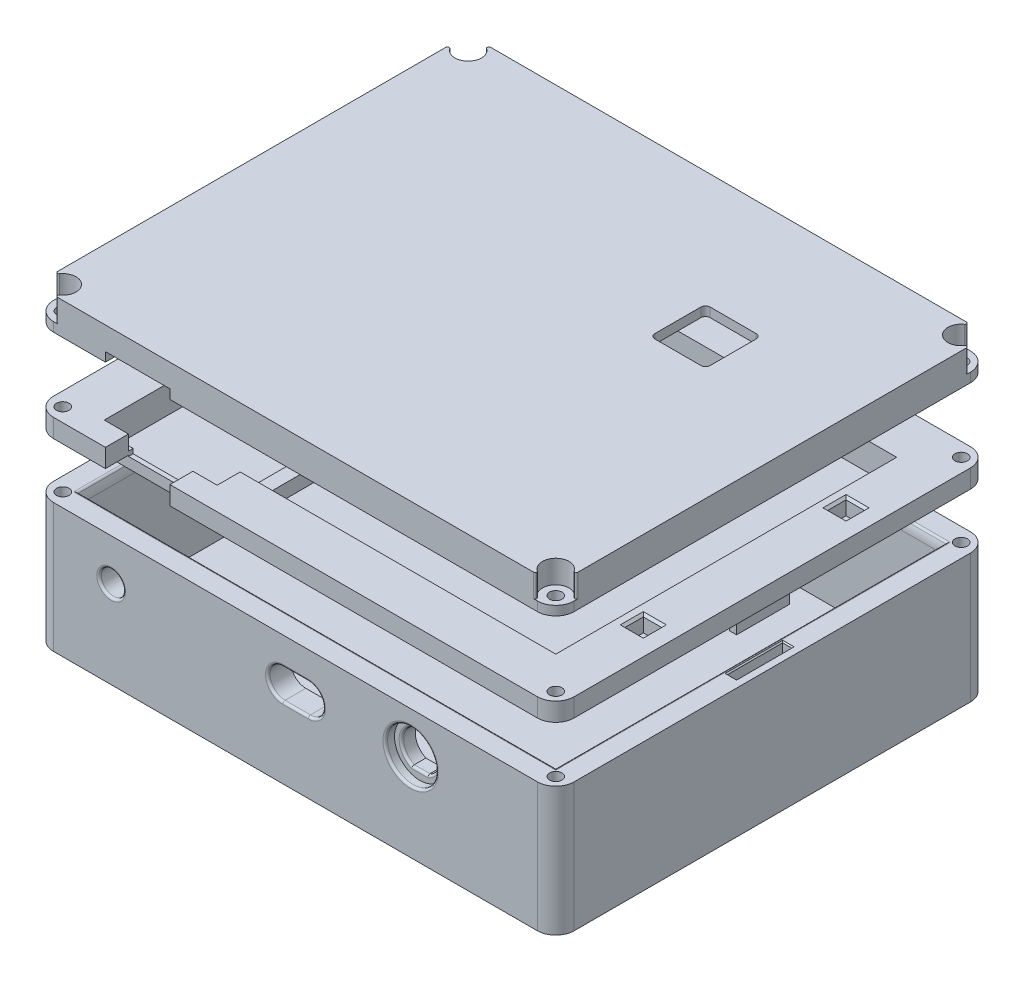
from build123d import *

# Parameters (mm, degrees)
BOSS_EXTRUDE1_DEPTH  = 4
BOSS_EXTRUDE2_START  = 4
SKETCH1_3_W          = 103
SKETCH1_3_H          = 84
BOSS_EXTRUDE2_DEPTH  = 24
BOSS_EXTRUDE3_START  = 4
SKETCH1_4_W          = 1.5
SKETCH1_4_H          = 12
SKETCH1_4_W_2        = 2.5
SKETCH1_4_H_2        = 1.5
BOSS_EXTRUDE3_DEPTH  = 8
CHAMFER1_SIZE        = 1
SKETCH2_R            = 2.625
CUT_EXTRUDE1_DEPTH   = 11
CUT_EXTRUDE2_START   = 5
SKETCH2_3_R          = 5.5
CUT_EXTRUDE2_DEPTH   = 2
CHAMFER2_SIZE        = 0.5
FILLET1_R            = 5
FILLET2_R            = 0.5
SKETCH3_R            = 1.35
CUT_EXTRUDE3_DEPTH   = 8
SKETCH3_3_W          = 2
SKETCH3_3_H          = 12
CUT_EXTRUDE12_DEPTH  = 4
SKETCH4_R            = 1.35
SKETCH4_W            = 103
SKETCH4_H            = 84
BOSS_EXTRUDE4_DEPTH  = 4
SKETCH4_5_W          = 1.5
SKETCH4_5_H          = 11.5
BOSS_EXTRUDE7_DEPTH  = 4
BOSS_EXTRUDE5_DEPTH  = 4
BOSS_EXTRUDE6_START  = -4
SKETCH4_4_W          = 93
SKETCH4_4_H          = 74
BOSS_EXTRUDE6_DEPTH  = 2
SKETCH5_W            = 24.5
SKETCH5_H            = 2
BOSS_EXTRUDE8_DEPTH  = 5
CHAMFER3_SIZE        = 1.5
SKETCH7_W            = 24.5
SKETCH7_H            = 3.053918574
BOSS_EXTRUDE11_DEPTH = 1
SKETCH6_W            = 14
SKETCH6_H            = 5.018415589
CUT_EXTRUDE4_DEPTH   = 7.5
BOSS_EXTRUDE12_DEPTH = 3
SKETCH8_3_W          = 16
SKETCH8_3_H          = 4
CUT_EXTRUDE5_DEPTH   = 3.5
CHAMFER4_SIZE        = 1
CUT_EXTRUDE6_START   = 6
SKETCH10_W           = 4
SKETCH10_H           = 4
CUT_EXTRUDE6_DEPTH   = 3.5
SKETCH10_3_R         = 0.8
BOSS_EXTRUDE13_DEPTH = 1.5
SKETCH10_4_W         = 2
SKETCH10_4_H         = 1.75
CUT_EXTRUDE7_DEPTH   = 2
FILLET3_R            = 0.5
CHAMFER5_SIZE        = 0.5
SKETCH12_W           = 3.3
SKETCH12_H           = 3.3
BOSS_EXTRUDE14_DEPTH = 5
SKETCH13_W           = 14
SKETCH13_H           = 2
CUT_EXTRUDE8_DEPTH   = 10
BOSS_EXTRUDE15_START = 5
SKETCH12_3_W         = 3.3
SKETCH12_3_H         = 3.3
BOSS_EXTRUDE15_DEPTH = 2
CUT_EXTRUDE9_START   = 7
SKETCH14_R           = 1.35
CUT_EXTRUDE9_DEPTH   = 7
CUT_EXTRUDE10_START  = 2
SKETCH14_3_R         = 2.875
CUT_EXTRUDE10_DEPTH  = 5
FILLET4_R            = 0.35
SKETCH17_R           = 5
CUT_EXTRUDE11_DEPTH  = 5
CHAMFER6_SIZE        = 0.25
FILLET5_R            = 1
FILLET6_R            = 0.5
SKETCH18_W           = 4
SKETCH18_H           = 4
SKETCH18_W_2         = 3
SKETCH18_H_2         = 3
CUT_EXTRUDE13_DEPTH  = 3
CHAMFER7_SIZE        = 0.325


with BuildPart() as part:
    # Sketch1 → Boss-Extrude1 (new body)
    with BuildSketch(Plane(origin=(0, 0, 0), x_dir=(1, 0, 0), z_dir=(0, 1, 0))):
        with BuildLine():
            Line((-1, 89), (104, 89))
            ThreePointArc((104, 89), (106.828427125, 87.828427125), (108, 85))
            Line((108, 85), (108, -1))
            ThreePointArc((108, -1), (106.828427125, -3.828427125), (104, -5))
            Line((104, -5), (-1, -5))
            ThreePointArc((-1, -5), (-3.828427125, -3.828427125), (-5, -1))
            Line((-5, -1), (-5, 85))
            ThreePointArc((-5, 85), (-3.828427125, 87.828427125), (-1, 89))
        make_face()
    extrude(amount=BOSS_EXTRUDE1_DEPTH)

    # Sketch1<3> → Boss-Extrude2 (add)
    with BuildSketch(Plane(origin=(0, 0, 0), x_dir=(1, 0, 0), z_dir=(0, 1, 0)).offset(BOSS_EXTRUDE2_START)):
        with BuildLine():
            Line((-1, 89), (104, 89))
            ThreePointArc((104, 89), (106.828427125, 87.828427125), (108, 85))
            Line((108, 85), (108, -1))
            ThreePointArc((108, -1), (106.828427125, -3.828427125), (104, -5))
            Line((104, -5), (-1, -5))
            ThreePointArc((-1, -5), (-3.828427125, -3.828427125), (-5, -1))
            Line((-5, -1), (-5, 85))
            ThreePointArc((-5, 85), (-3.828427125, 87.828427125), (-1, 89))
        make_face()
        with Locations((51.5, 42)):
            Rectangle(SKETCH1_3_W, SKETCH1_3_H, mode=Mode.SUBTRACT)
    extrude(amount=BOSS_EXTRUDE2_DEPTH)

    # Sketch1<4> → Boss-Extrude3 (add)
    with BuildSketch(Plane(origin=(0, 0, 0), x_dir=(1, 0, 0), z_dir=(0, 1, 0)).offset(BOSS_EXTRUDE3_START)):
        with Locations((0.75, 78)):
            Rectangle(SKETCH1_4_W, SKETCH1_4_H)
        Polygon((0, 13.5), (0, 0), (1.5, 0), (1.5, 1.5), (1.5, 13.5), align=None)
        with Locations((2.75, 0.75)):
            Rectangle(SKETCH1_4_W_2, SKETCH1_4_H_2)
    extrude(amount=BOSS_EXTRUDE3_DEPTH)

    # Chamfer1
    chamfer1_edges = [part.edges().sort_by_distance(p)[0] for p in [
        (0.75, 12, -72),
        (1.5, 12, -78),
        (1.5, 12, -7.5),
        (0.75, 12, -13.5),
        (4, 12, -0.75),
        (2.75, 12, -1.5),
    ]]
    chamfer(chamfer1_edges, length=CHAMFER1_SIZE)

    # Sketch2 → Cut-Extrude1 (cut)
    with BuildSketch(Plane.XY):
        with BuildLine():
            Line((48.75, 15.45), (54.25, 15.45))
            ThreePointArc((54.25, 15.45), (57.5, 18.7), (54.25, 21.95))
            Line((54.25, 21.95), (48.75, 21.95))
            ThreePointArc((48.75, 21.95), (45.5, 18.7), (48.75, 15.45))
        make_face()
        with BuildLine():
            Line((74.809031343, 15.375), (78.190968657, 15.375))
            ThreePointArc((78.190968657, 15.375), (80.5, 19), (78.190968657, 22.625))
            Line((78.190968657, 22.625), (74.809031343, 22.625))
            ThreePointArc((74.809031343, 22.625), (72.5, 19), (74.809031343, 15.375))
        make_face()
        with Locations(Location((11.5, 19, 0), (0, 0, 180))):
            Circle(SKETCH2_R)
    extrude(amount=CUT_EXTRUDE1_DEPTH, mode=Mode.SUBTRACT)

    # Sketch2<3> → Cut-Extrude2 (cut)
    with BuildSketch(Plane.XY.offset(CUT_EXTRUDE2_START)):
        with Locations(Location((76.5, 19, 0), (0, 0, 180))):
            Circle(SKETCH2_3_R)
    extrude(amount=-CUT_EXTRUDE2_DEPTH, mode=Mode.SUBTRACT)

    # Chamfer2
    chamfer2_edges = [part.edges().sort_by_distance(p)[0] for p in [
        (0, 28, -42),
        (51.5, 28, -84),
        (51.5, 28, 0),
        (103, 28, -42),
    ]]
    chamfer(chamfer2_edges, length=CHAMFER2_SIZE)

    # Fillet1
    # the kernel refuses this fillet: 5 mm, written as the material it takes off along each edge
    with BuildSketch(Plane(origin=(-4.198623679, 27.5, 0), x_dir=(0, -1, 0), z_dir=(1, 0, 0))) as fillet1_piece_1_section:
        with BuildLine():
            CenterArc((1.679449472, -5), FILLET1_R, 90, 25.841932763)
            Line((-0.5, -0.5), (-0.543588989, -0.41))
            ThreePointArc((-0.543588989, -0.41), (-0.320710678, -0.179289322), (-0.070710678, 0.070710678))
            Line((-0.070710678, 0.070710678), (0, 0.1))
            Line((0, 0.1), (1.679449472, 0.1))
            Line((1.679449472, 0.1), (1.679449472, 0))
        make_face()
    fillet1_piece_1 = extrude(amount=107.198623679, mode=Mode.PRIVATE)
    fillet1_piece_1 = split(fillet1_piece_1, bisect_by=Plane(origin=(0, 27.809434644, 0.291148334), z_dir=(-1, 0, 0)), keep=Keep.TOP, mode=Mode.PRIVATE)
    fillet1_piece_1 = split(fillet1_piece_1, bisect_by=Plane(origin=(-0.232075983, 27.732075983, 0.291148334), z_dir=(0.7071067811865476, 0.7071067811865476, 0)), keep=Keep.TOP, mode=Mode.PRIVATE)
    add(fillet1_piece_1, mode=Mode.SUBTRACT)
    with BuildSketch(Plane(origin=(0, 27.5, 0), x_dir=(0, -1, 0), z_dir=(1, 0, 0))) as fillet1_piece_2_section:
        with BuildLine():
            CenterArc((1.679449472, -5), FILLET1_R, 90, 25.841932763)
            Line((-0.5, -0.5), (-0.543588989, -0.41))
            ThreePointArc((-0.543588989, -0.41), (-0.320710678, -0.179289322), (-0.070710678, 0.070710678))
            Line((-0.070710678, 0.070710678), (0, 0.1))
            Line((0, 0.1), (1.679449472, 0.1))
            Line((1.679449472, 0.1), (1.679449472, 0))
        make_face()
    fillet1_piece_2 = extrude(amount=103, mode=Mode.PRIVATE)
    fillet1_piece_2 = split(fillet1_piece_2, bisect_by=Plane(origin=(0.730926762, 26.769073238, -0.015345382), z_dir=(-0.7071067811865476, -0.7071067811865476, 0)), keep=Keep.TOP, mode=Mode.PRIVATE)
    add(fillet1_piece_2, mode=Mode.SUBTRACT)
    with BuildSketch(Plane(origin=(0, 27.5, 0), x_dir=(0, -1, 0), z_dir=(1, 0, 0))) as fillet1_piece_3_section:
        with BuildLine():
            CenterArc((1.679449472, -5), FILLET1_R, 90, 25.841932763)
            Line((-0.5, -0.5), (-0.543588989, -0.41))
            ThreePointArc((-0.543588989, -0.41), (-0.320710678, -0.179289322), (-0.070710678, 0.070710678))
            Line((-0.070710678, 0.070710678), (0, 0.1))
            Line((0, 0.1), (1.679449472, 0.1))
            Line((1.679449472, 0.1), (1.679449472, 0))
        make_face()
    fillet1_piece_3 = extrude(amount=103, mode=Mode.PRIVATE)
    fillet1_piece_3 = split(fillet1_piece_3, bisect_by=Plane(origin=(25.936183283, 1.563816717, 0.080709019), z_dir=(0.7071067811865476, 0.7071067811865476, 0)), keep=Keep.TOP, mode=Mode.PRIVATE)
    fillet1_piece_3 = split(fillet1_piece_3, bisect_by=Plane(origin=(77.063816717, 1.563816717, 0.080709019), z_dir=(-0.7071067811865476, 0.7071067811865476, 0)), keep=Keep.TOP, mode=Mode.PRIVATE)
    add(fillet1_piece_3, mode=Mode.SUBTRACT)
    with BuildSketch(Plane(origin=(0, 27.5, 0), x_dir=(0, -1, 0), z_dir=(1, 0, 0))) as fillet1_piece_4_section:
        with BuildLine():
            CenterArc((1.679449472, -5), FILLET1_R, 90, 25.841932763)
            Line((-0.5, -0.5), (-0.543588989, -0.41))
            ThreePointArc((-0.543588989, -0.41), (-0.320710678, -0.179289322), (-0.070710678, 0.070710678))
            Line((-0.070710678, 0.070710678), (0, 0.1))
            Line((0, 0.1), (1.679449472, 0.1))
            Line((1.679449472, 0.1), (1.679449472, 0))
        make_face()
    fillet1_piece_4 = extrude(amount=107.198623679, mode=Mode.PRIVATE)
    fillet1_piece_4 = split(fillet1_piece_4, bisect_by=Plane(origin=(103, 27.809434644, 0.291148334), z_dir=(1, 0, 0)), keep=Keep.TOP, mode=Mode.PRIVATE)
    fillet1_piece_4 = split(fillet1_piece_4, bisect_by=Plane(origin=(103.232075983, 27.732075983, 0.291148334), z_dir=(-0.7071067811865476, 0.7071067811865476, 0)), keep=Keep.TOP, mode=Mode.PRIVATE)
    add(fillet1_piece_4, mode=Mode.SUBTRACT)
    with BuildSketch(Plane(origin=(0, 27.5, 0), x_dir=(0, -1, 0), z_dir=(1, 0, 0))) as fillet1_piece_5_section:
        with BuildLine():
            CenterArc((1.679449472, -5), FILLET1_R, 90, 25.841932763)
            Line((-0.5, -0.5), (-0.543588989, -0.41))
            ThreePointArc((-0.543588989, -0.41), (-0.320710678, -0.179289322), (-0.070710678, 0.070710678))
            Line((-0.070710678, 0.070710678), (0, 0.1))
            Line((0, 0.1), (1.679449472, 0.1))
            Line((1.679449472, 0.1), (1.679449472, 0))
        make_face()
    fillet1_piece_5 = extrude(amount=103, mode=Mode.PRIVATE)
    fillet1_piece_5 = split(fillet1_piece_5, bisect_by=Plane(origin=(102.269073238, 26.769073238, -0.015345382), z_dir=(0.7071067811865476, -0.7071067811865476, 0)), keep=Keep.TOP, mode=Mode.PRIVATE)
    add(fillet1_piece_5, mode=Mode.SUBTRACT)
    with BuildSketch(Plane(origin=(103, 27.5, 4.198623679), x_dir=(0, -1, 0), z_dir=(0, 0, -1))) as fillet1_piece_6_section:
        with BuildLine():
            CenterArc((1.679449472, -5), FILLET1_R, 90, 25.841932763)
            Line((-0.5, -0.5), (-0.543588989, -0.41))
            ThreePointArc((-0.543588989, -0.41), (-0.320710678, -0.179289322), (-0.070710678, 0.070710678))
            Line((-0.070710678, 0.070710678), (0, 0.1))
            Line((0, 0.1), (1.679449472, 0.1))
            Line((1.679449472, 0.1), (1.679449472, 0))
        make_face()
    fillet1_piece_6 = extrude(amount=88.198623679, mode=Mode.PRIVATE)
    fillet1_piece_6 = split(fillet1_piece_6, bisect_by=Plane(origin=(103.291148334, 27.809434644, 0), z_dir=(0, 0, 1)), keep=Keep.TOP, mode=Mode.PRIVATE)
    fillet1_piece_6 = split(fillet1_piece_6, bisect_by=Plane(origin=(103.291148334, 27.732075983, 0.232075983), z_dir=(0, 0.7071067811865476, -0.7071067811865476)), keep=Keep.TOP, mode=Mode.PRIVATE)
    add(fillet1_piece_6, mode=Mode.SUBTRACT)
    with BuildSketch(Plane(origin=(103, 27.5, 0), x_dir=(0, -1, 0), z_dir=(0, 0, -1))) as fillet1_piece_7_section:
        with BuildLine():
            CenterArc((1.679449472, -5), FILLET1_R, 90, 25.841932763)
            Line((-0.5, -0.5), (-0.543588989, -0.41))
            ThreePointArc((-0.543588989, -0.41), (-0.320710678, -0.179289322), (-0.070710678, 0.070710678))
            Line((-0.070710678, 0.070710678), (0, 0.1))
            Line((0, 0.1), (1.679449472, 0.1))
            Line((1.679449472, 0.1), (1.679449472, 0))
        make_face()
    fillet1_piece_7 = extrude(amount=84, mode=Mode.PRIVATE)
    fillet1_piece_7 = split(fillet1_piece_7, bisect_by=Plane(origin=(102.984654618, 26.769073238, -0.730926762), z_dir=(0, -0.7071067811865476, 0.7071067811865476)), keep=Keep.TOP, mode=Mode.PRIVATE)
    add(fillet1_piece_7, mode=Mode.SUBTRACT)
    with BuildSketch(Plane(origin=(103, 27.5, 0), x_dir=(0, -1, 0), z_dir=(0, 0, -1))) as fillet1_piece_8_section:
        with BuildLine():
            CenterArc((1.679449472, -5), FILLET1_R, 90, 25.841932763)
            Line((-0.5, -0.5), (-0.543588989, -0.41))
            ThreePointArc((-0.543588989, -0.41), (-0.320710678, -0.179289322), (-0.070710678, 0.070710678))
            Line((-0.070710678, 0.070710678), (0, 0.1))
            Line((0, 0.1), (1.679449472, 0.1))
            Line((1.679449472, 0.1), (1.679449472, 0))
        make_face()
    fillet1_piece_8 = extrude(amount=84, mode=Mode.PRIVATE)
    fillet1_piece_8 = split(fillet1_piece_8, bisect_by=Plane(origin=(103.080897573, 6.314407777, -21.185592223), z_dir=(0, 0.7071067811865476, -0.7071067811865476)), keep=Keep.TOP, mode=Mode.PRIVATE)
    fillet1_piece_8 = split(fillet1_piece_8, bisect_by=Plane(origin=(103.080897573, 6.314407777, -62.814407777), z_dir=(0, 0.7071067811865476, 0.7071067811865476)), keep=Keep.TOP, mode=Mode.PRIVATE)
    add(fillet1_piece_8, mode=Mode.SUBTRACT)
    with BuildSketch(Plane(origin=(103, 27.5, 0), x_dir=(0, -1, 0), z_dir=(0, 0, -1))) as fillet1_piece_9_section:
        with BuildLine():
            CenterArc((1.679449472, -5), FILLET1_R, 90, 25.841932763)
            Line((-0.5, -0.5), (-0.543588989, -0.41))
            ThreePointArc((-0.543588989, -0.41), (-0.320710678, -0.179289322), (-0.070710678, 0.070710678))
            Line((-0.070710678, 0.070710678), (0, 0.1))
            Line((0, 0.1), (1.679449472, 0.1))
            Line((1.679449472, 0.1), (1.679449472, 0))
        make_face()
    fillet1_piece_9 = extrude(amount=88.198623679, mode=Mode.PRIVATE)
    fillet1_piece_9 = split(fillet1_piece_9, bisect_by=Plane(origin=(103.291148334, 27.809434644, -84), z_dir=(0, 0, -1)), keep=Keep.TOP, mode=Mode.PRIVATE)
    fillet1_piece_9 = split(fillet1_piece_9, bisect_by=Plane(origin=(103.291148334, 27.732075983, -84.232075983), z_dir=(0, 0.7071067811865476, 0.7071067811865476)), keep=Keep.TOP, mode=Mode.PRIVATE)
    add(fillet1_piece_9, mode=Mode.SUBTRACT)
    with BuildSketch(Plane(origin=(103, 27.5, 0), x_dir=(0, -1, 0), z_dir=(0, 0, -1))) as fillet1_piece_10_section:
        with BuildLine():
            CenterArc((1.679449472, -5), FILLET1_R, 90, 25.841932763)
            Line((-0.5, -0.5), (-0.543588989, -0.41))
            ThreePointArc((-0.543588989, -0.41), (-0.320710678, -0.179289322), (-0.070710678, 0.070710678))
            Line((-0.070710678, 0.070710678), (0, 0.1))
            Line((0, 0.1), (1.679449472, 0.1))
            Line((1.679449472, 0.1), (1.679449472, 0))
        make_face()
    fillet1_piece_10 = extrude(amount=84, mode=Mode.PRIVATE)
    fillet1_piece_10 = split(fillet1_piece_10, bisect_by=Plane(origin=(102.984654618, 26.769073238, -83.269073238), z_dir=(0, -0.7071067811865476, -0.7071067811865476)), keep=Keep.TOP, mode=Mode.PRIVATE)
    add(fillet1_piece_10, mode=Mode.SUBTRACT)
    with BuildSketch(Plane(origin=(107.198623679, 27.5, -84), x_dir=(0, -1, 0), z_dir=(-1, 0, 0))) as fillet1_piece_11_section:
        with BuildLine():
            CenterArc((1.679449472, -5), FILLET1_R, 90, 25.841932763)
            Line((-0.5, -0.5), (-0.543588989, -0.41))
            ThreePointArc((-0.543588989, -0.41), (-0.320710678, -0.179289322), (-0.070710678, 0.070710678))
            Line((-0.070710678, 0.070710678), (0, 0.1))
            Line((0, 0.1), (1.679449472, 0.1))
            Line((1.679449472, 0.1), (1.679449472, 0))
        make_face()
    fillet1_piece_11 = extrude(amount=107.198623679, mode=Mode.PRIVATE)
    fillet1_piece_11 = split(fillet1_piece_11, bisect_by=Plane(origin=(103, 27.809434644, -84.291148334), z_dir=(1, 0, 0)), keep=Keep.TOP, mode=Mode.PRIVATE)
    fillet1_piece_11 = split(fillet1_piece_11, bisect_by=Plane(origin=(103.232075983, 27.732075983, -84.291148334), z_dir=(-0.7071067811865476, 0.7071067811865476, 0)), keep=Keep.TOP, mode=Mode.PRIVATE)
    add(fillet1_piece_11, mode=Mode.SUBTRACT)
    with BuildSketch(Plane(origin=(103, 27.5, -84), x_dir=(0, -1, 0), z_dir=(-1, 0, 0))) as fillet1_piece_12_section:
        with BuildLine():
            CenterArc((1.679449472, -5), FILLET1_R, 90, 25.841932763)
            Line((-0.5, -0.5), (-0.543588989, -0.41))
            ThreePointArc((-0.543588989, -0.41), (-0.320710678, -0.179289322), (-0.070710678, 0.070710678))
            Line((-0.070710678, 0.070710678), (0, 0.1))
            Line((0, 0.1), (1.679449472, 0.1))
            Line((1.679449472, 0.1), (1.679449472, 0))
        make_face()
    fillet1_piece_12 = extrude(amount=103, mode=Mode.PRIVATE)
    fillet1_piece_12 = split(fillet1_piece_12, bisect_by=Plane(origin=(102.269073238, 26.769073238, -83.984654618), z_dir=(0.7071067811865476, -0.7071067811865476, 0)), keep=Keep.TOP, mode=Mode.PRIVATE)
    add(fillet1_piece_12, mode=Mode.SUBTRACT)
    with BuildSketch(Plane(origin=(103, 27.5, -84), x_dir=(0, -1, 0), z_dir=(-1, 0, 0))) as fillet1_piece_13_section:
        with BuildLine():
            CenterArc((1.679449472, -5), FILLET1_R, 90, 25.841932763)
            Line((-0.5, -0.5), (-0.543588989, -0.41))
            ThreePointArc((-0.543588989, -0.41), (-0.320710678, -0.179289322), (-0.070710678, 0.070710678))
            Line((-0.070710678, 0.070710678), (0, 0.1))
            Line((0, 0.1), (1.679449472, 0.1))
            Line((1.679449472, 0.1), (1.679449472, 0))
        make_face()
    fillet1_piece_13 = extrude(amount=103, mode=Mode.PRIVATE)
    fillet1_piece_13 = split(fillet1_piece_13, bisect_by=Plane(origin=(25.936183283, 1.563816717, -84.080709019), z_dir=(0.7071067811865476, 0.7071067811865476, 0)), keep=Keep.TOP, mode=Mode.PRIVATE)
    fillet1_piece_13 = split(fillet1_piece_13, bisect_by=Plane(origin=(77.063816717, 1.563816717, -84.080709019), z_dir=(-0.7071067811865476, 0.7071067811865476, 0)), keep=Keep.TOP, mode=Mode.PRIVATE)
    add(fillet1_piece_13, mode=Mode.SUBTRACT)
    with BuildSketch(Plane(origin=(103, 27.5, -84), x_dir=(0, -1, 0), z_dir=(-1, 0, 0))) as fillet1_piece_14_section:
        with BuildLine():
            CenterArc((1.679449472, -5), FILLET1_R, 90, 25.841932763)
            Line((-0.5, -0.5), (-0.543588989, -0.41))
            ThreePointArc((-0.543588989, -0.41), (-0.320710678, -0.179289322), (-0.070710678, 0.070710678))
            Line((-0.070710678, 0.070710678), (0, 0.1))
            Line((0, 0.1), (1.679449472, 0.1))
            Line((1.679449472, 0.1), (1.679449472, 0))
        make_face()
    fillet1_piece_14 = extrude(amount=107.198623679, mode=Mode.PRIVATE)
    fillet1_piece_14 = split(fillet1_piece_14, bisect_by=Plane(origin=(0, 27.809434644, -84.291148334), z_dir=(-1, 0, 0)), keep=Keep.TOP, mode=Mode.PRIVATE)
    fillet1_piece_14 = split(fillet1_piece_14, bisect_by=Plane(origin=(-0.232075983, 27.732075983, -84.291148334), z_dir=(0.7071067811865476, 0.7071067811865476, 0)), keep=Keep.TOP, mode=Mode.PRIVATE)
    add(fillet1_piece_14, mode=Mode.SUBTRACT)
    with BuildSketch(Plane(origin=(103, 27.5, -84), x_dir=(0, -1, 0), z_dir=(-1, 0, 0))) as fillet1_piece_15_section:
        with BuildLine():
            CenterArc((1.679449472, -5), FILLET1_R, 90, 25.841932763)
            Line((-0.5, -0.5), (-0.543588989, -0.41))
            ThreePointArc((-0.543588989, -0.41), (-0.320710678, -0.179289322), (-0.070710678, 0.070710678))
            Line((-0.070710678, 0.070710678), (0, 0.1))
            Line((0, 0.1), (1.679449472, 0.1))
            Line((1.679449472, 0.1), (1.679449472, 0))
        make_face()
    fillet1_piece_15 = extrude(amount=103, mode=Mode.PRIVATE)
    fillet1_piece_15 = split(fillet1_piece_15, bisect_by=Plane(origin=(0.730926762, 26.769073238, -83.984654618), z_dir=(-0.7071067811865476, -0.7071067811865476, 0)), keep=Keep.TOP, mode=Mode.PRIVATE)
    add(fillet1_piece_15, mode=Mode.SUBTRACT)
    with BuildSketch(Plane(origin=(0, 27.5, -88.198623679), x_dir=(0, -1, 0), z_dir=(0, 0, 1))) as fillet1_piece_16_section:
        with BuildLine():
            CenterArc((1.679449472, -5), FILLET1_R, 90, 25.841932763)
            Line((-0.5, -0.5), (-0.543588989, -0.41))
            ThreePointArc((-0.543588989, -0.41), (-0.320710678, -0.179289322), (-0.070710678, 0.070710678))
            Line((-0.070710678, 0.070710678), (0, 0.1))
            Line((0, 0.1), (1.679449472, 0.1))
            Line((1.679449472, 0.1), (1.679449472, 0))
        make_face()
    fillet1_piece_16 = extrude(amount=88.198623679, mode=Mode.PRIVATE)
    fillet1_piece_16 = split(fillet1_piece_16, bisect_by=Plane(origin=(-0.291148334, 27.809434644, -84), z_dir=(0, 0, -1)), keep=Keep.TOP, mode=Mode.PRIVATE)
    fillet1_piece_16 = split(fillet1_piece_16, bisect_by=Plane(origin=(-0.291148334, 27.732075983, -84.232075983), z_dir=(0, 0.7071067811865476, 0.7071067811865476)), keep=Keep.TOP, mode=Mode.PRIVATE)
    add(fillet1_piece_16, mode=Mode.SUBTRACT)
    with BuildSketch(Plane(origin=(0, 27.5, -84), x_dir=(0, -1, 0), z_dir=(0, 0, 1))) as fillet1_piece_17_section:
        with BuildLine():
            CenterArc((1.679449472, -5), FILLET1_R, 90, 25.841932763)
            Line((-0.5, -0.5), (-0.543588989, -0.41))
            ThreePointArc((-0.543588989, -0.41), (-0.320710678, -0.179289322), (-0.070710678, 0.070710678))
            Line((-0.070710678, 0.070710678), (0, 0.1))
            Line((0, 0.1), (1.679449472, 0.1))
            Line((1.679449472, 0.1), (1.679449472, 0))
        make_face()
    fillet1_piece_17 = extrude(amount=84, mode=Mode.PRIVATE)
    fillet1_piece_17 = split(fillet1_piece_17, bisect_by=Plane(origin=(0.015345382, 26.769073238, -83.269073238), z_dir=(0, -0.7071067811865476, -0.7071067811865476)), keep=Keep.TOP, mode=Mode.PRIVATE)
    add(fillet1_piece_17, mode=Mode.SUBTRACT)
    with BuildSketch(Plane(origin=(0, 27.5, -84), x_dir=(0, -1, 0), z_dir=(0, 0, 1))) as fillet1_piece_18_section:
        with BuildLine():
            CenterArc((1.679449472, -5), FILLET1_R, 90, 25.841932763)
            Line((-0.5, -0.5), (-0.543588989, -0.41))
            ThreePointArc((-0.543588989, -0.41), (-0.320710678, -0.179289322), (-0.070710678, 0.070710678))
            Line((-0.070710678, 0.070710678), (0, 0.1))
            Line((0, 0.1), (1.679449472, 0.1))
            Line((1.679449472, 0.1), (1.679449472, 0))
        make_face()
    fillet1_piece_18 = extrude(amount=84, mode=Mode.PRIVATE)
    fillet1_piece_18 = split(fillet1_piece_18, bisect_by=Plane(origin=(-0.080897573, 6.314407777, -21.185592223), z_dir=(0, 0.7071067811865476, -0.7071067811865476)), keep=Keep.TOP, mode=Mode.PRIVATE)
    fillet1_piece_18 = split(fillet1_piece_18, bisect_by=Plane(origin=(-0.080897573, 6.314407777, -62.814407777), z_dir=(0, 0.7071067811865476, 0.7071067811865476)), keep=Keep.TOP, mode=Mode.PRIVATE)
    add(fillet1_piece_18, mode=Mode.SUBTRACT)
    with BuildSketch(Plane(origin=(0, 27.5, -84), x_dir=(0, -1, 0), z_dir=(0, 0, 1))) as fillet1_piece_19_section:
        with BuildLine():
            CenterArc((1.679449472, -5), FILLET1_R, 90, 25.841932763)
            Line((-0.5, -0.5), (-0.543588989, -0.41))
            ThreePointArc((-0.543588989, -0.41), (-0.320710678, -0.179289322), (-0.070710678, 0.070710678))
            Line((-0.070710678, 0.070710678), (0, 0.1))
            Line((0, 0.1), (1.679449472, 0.1))
            Line((1.679449472, 0.1), (1.679449472, 0))
        make_face()
    fillet1_piece_19 = extrude(amount=88.198623679, mode=Mode.PRIVATE)
    fillet1_piece_19 = split(fillet1_piece_19, bisect_by=Plane(origin=(-0.291148334, 27.809434644, 0), z_dir=(0, 0, 1)), keep=Keep.TOP, mode=Mode.PRIVATE)
    fillet1_piece_19 = split(fillet1_piece_19, bisect_by=Plane(origin=(-0.291148334, 27.732075983, 0.232075983), z_dir=(0, 0.7071067811865476, -0.7071067811865476)), keep=Keep.TOP, mode=Mode.PRIVATE)
    add(fillet1_piece_19, mode=Mode.SUBTRACT)
    with BuildSketch(Plane(origin=(0, 27.5, -84), x_dir=(0, -1, 0), z_dir=(0, 0, 1))) as fillet1_piece_20_section:
        with BuildLine():
            CenterArc((1.679449472, -5), FILLET1_R, 90, 25.841932763)
            Line((-0.5, -0.5), (-0.543588989, -0.41))
            ThreePointArc((-0.543588989, -0.41), (-0.320710678, -0.179289322), (-0.070710678, 0.070710678))
            Line((-0.070710678, 0.070710678), (0, 0.1))
            Line((0, 0.1), (1.679449472, 0.1))
            Line((1.679449472, 0.1), (1.679449472, 0))
        make_face()
    fillet1_piece_20 = extrude(amount=84, mode=Mode.PRIVATE)
    fillet1_piece_20 = split(fillet1_piece_20, bisect_by=Plane(origin=(0.015345382, 26.769073238, -0.730926762), z_dir=(0, -0.7071067811865476, 0.7071067811865476)), keep=Keep.TOP, mode=Mode.PRIVATE)
    add(fillet1_piece_20, mode=Mode.SUBTRACT)
    with BuildSketch(Plane(origin=(-4.198623679, 27.5, 0), x_dir=(0, -1, 0), z_dir=(1, 0, 0))) as fillet1_piece_21a_section:
        with BuildLine():
            CenterArc((1.679449472, -5), FILLET1_R, 90, 25.841932763)
            Line((-0.5, -0.5), (-0.543588989, -0.41))
            ThreePointArc((-0.543588989, -0.41), (-0.320710678, -0.179289322), (-0.070710678, 0.070710678))
            Line((-0.070710678, 0.070710678), (0, 0.1))
            Line((0, 0.1), (1.679449472, 0.1))
            Line((1.679449472, 0.1), (1.679449472, 0))
        make_face()
    fillet1_piece_21a = extrude(amount=107.198623679, mode=Mode.PRIVATE)
    fillet1_piece_21a = split(fillet1_piece_21a, bisect_by=Plane(origin=(0, 27.111710691, 0.076577768), z_dir=(-1, 0, 0)), keep=Keep.TOP, mode=Mode.PRIVATE)
    fillet1_piece_21a = split(fillet1_piece_21a, bisect_by=Plane(origin=(-0.870728347, 28.370728347, 0.076577768), z_dir=(-0.7071067811865476, -0.7071067811865476, 0)), keep=Keep.TOP, mode=Mode.PRIVATE)
    with BuildSketch(Plane(origin=(0, 27.5, -84), x_dir=(0, -1, 0), z_dir=(0, 0, 1))) as fillet1_piece_21b_section:
        with BuildLine():
            CenterArc((1.679449472, -5), FILLET1_R, 90, 25.841932763)
            Line((-0.5, -0.5), (-0.543588989, -0.41))
            ThreePointArc((-0.543588989, -0.41), (-0.320710678, -0.179289322), (-0.070710678, 0.070710678))
            Line((-0.070710678, 0.070710678), (0, 0.1))
            Line((0, 0.1), (1.679449472, 0.1))
            Line((1.679449472, 0.1), (1.679449472, 0))
        make_face()
    fillet1_piece_21b = extrude(amount=88.198623679, mode=Mode.PRIVATE)
    fillet1_piece_21b = split(fillet1_piece_21b, bisect_by=Plane(origin=(-0.076577768, 27.111710691, 0), z_dir=(0, 0, 1)), keep=Keep.TOP, mode=Mode.PRIVATE)
    fillet1_piece_21b = split(fillet1_piece_21b, bisect_by=Plane(origin=(-0.076577768, 28.370728347, 0.870728347), z_dir=(0, -0.7071067811865476, 0.7071067811865476)), keep=Keep.TOP, mode=Mode.PRIVATE)
    fillet1_piece_21 = fillet1_piece_21a & fillet1_piece_21b
    add(fillet1_piece_21, mode=Mode.SUBTRACT)
    with BuildSketch(Plane(origin=(0, 27.5, 0), x_dir=(0, -1, 0), z_dir=(1, 0, 0))) as fillet1_piece_22a_section:
        with BuildLine():
            CenterArc((1.679449472, -5), FILLET1_R, 90, 25.841932763)
            Line((-0.5, -0.5), (-0.543588989, -0.41))
            ThreePointArc((-0.543588989, -0.41), (-0.320710678, -0.179289322), (-0.070710678, 0.070710678))
            Line((-0.070710678, 0.070710678), (0, 0.1))
            Line((0, 0.1), (1.679449472, 0.1))
            Line((1.679449472, 0.1), (1.679449472, 0))
        make_face()
    fillet1_piece_22a = extrude(amount=107.198623679, mode=Mode.PRIVATE)
    fillet1_piece_22a = split(fillet1_piece_22a, bisect_by=Plane(origin=(103, 27.111710691, 0.076577768), z_dir=(1, 0, 0)), keep=Keep.TOP, mode=Mode.PRIVATE)
    fillet1_piece_22a = split(fillet1_piece_22a, bisect_by=Plane(origin=(103.870728347, 28.370728347, 0.076577768), z_dir=(0.7071067811865476, -0.7071067811865476, 0)), keep=Keep.TOP, mode=Mode.PRIVATE)
    with BuildSketch(Plane(origin=(103, 27.5, 4.198623679), x_dir=(0, -1, 0), z_dir=(0, 0, -1))) as fillet1_piece_22b_section:
        with BuildLine():
            CenterArc((1.679449472, -5), FILLET1_R, 90, 25.841932763)
            Line((-0.5, -0.5), (-0.543588989, -0.41))
            ThreePointArc((-0.543588989, -0.41), (-0.320710678, -0.179289322), (-0.070710678, 0.070710678))
            Line((-0.070710678, 0.070710678), (0, 0.1))
            Line((0, 0.1), (1.679449472, 0.1))
            Line((1.679449472, 0.1), (1.679449472, 0))
        make_face()
    fillet1_piece_22b = extrude(amount=88.198623679, mode=Mode.PRIVATE)
    fillet1_piece_22b = split(fillet1_piece_22b, bisect_by=Plane(origin=(103.076577768, 27.111710691, 0), z_dir=(0, 0, 1)), keep=Keep.TOP, mode=Mode.PRIVATE)
    fillet1_piece_22b = split(fillet1_piece_22b, bisect_by=Plane(origin=(103.076577768, 28.370728347, 0.870728347), z_dir=(0, -0.7071067811865476, 0.7071067811865476)), keep=Keep.TOP, mode=Mode.PRIVATE)
    fillet1_piece_22 = fillet1_piece_22a & fillet1_piece_22b
    add(fillet1_piece_22, mode=Mode.SUBTRACT)
    with BuildSketch(Plane(origin=(103, 27.5, 0), x_dir=(0, -1, 0), z_dir=(0, 0, -1))) as fillet1_piece_23a_section:
        with BuildLine():
            CenterArc((1.679449472, -5), FILLET1_R, 90, 25.841932763)
            Line((-0.5, -0.5), (-0.543588989, -0.41))
            ThreePointArc((-0.543588989, -0.41), (-0.320710678, -0.179289322), (-0.070710678, 0.070710678))
            Line((-0.070710678, 0.070710678), (0, 0.1))
            Line((0, 0.1), (1.679449472, 0.1))
            Line((1.679449472, 0.1), (1.679449472, 0))
        make_face()
    fillet1_piece_23a = extrude(amount=88.198623679, mode=Mode.PRIVATE)
    fillet1_piece_23a = split(fillet1_piece_23a, bisect_by=Plane(origin=(103.076577768, 27.111710691, -84), z_dir=(0, 0, -1)), keep=Keep.TOP, mode=Mode.PRIVATE)
    fillet1_piece_23a = split(fillet1_piece_23a, bisect_by=Plane(origin=(103.076577768, 28.370728347, -84.870728347), z_dir=(0, -0.7071067811865476, -0.7071067811865476)), keep=Keep.TOP, mode=Mode.PRIVATE)
    with BuildSketch(Plane(origin=(107.198623679, 27.5, -84), x_dir=(0, -1, 0), z_dir=(-1, 0, 0))) as fillet1_piece_23b_section:
        with BuildLine():
            CenterArc((1.679449472, -5), FILLET1_R, 90, 25.841932763)
            Line((-0.5, -0.5), (-0.543588989, -0.41))
            ThreePointArc((-0.543588989, -0.41), (-0.320710678, -0.179289322), (-0.070710678, 0.070710678))
            Line((-0.070710678, 0.070710678), (0, 0.1))
            Line((0, 0.1), (1.679449472, 0.1))
            Line((1.679449472, 0.1), (1.679449472, 0))
        make_face()
    fillet1_piece_23b = extrude(amount=107.198623679, mode=Mode.PRIVATE)
    fillet1_piece_23b = split(fillet1_piece_23b, bisect_by=Plane(origin=(103, 27.111710691, -84.076577768), z_dir=(1, 0, 0)), keep=Keep.TOP, mode=Mode.PRIVATE)
    fillet1_piece_23b = split(fillet1_piece_23b, bisect_by=Plane(origin=(103.870728347, 28.370728347, -84.076577768), z_dir=(0.7071067811865476, -0.7071067811865476, 0)), keep=Keep.TOP, mode=Mode.PRIVATE)
    fillet1_piece_23 = fillet1_piece_23a & fillet1_piece_23b
    add(fillet1_piece_23, mode=Mode.SUBTRACT)
    with BuildSketch(Plane(origin=(0, 27.5, -88.198623679), x_dir=(0, -1, 0), z_dir=(0, 0, 1))) as fillet1_piece_24a_section:
        with BuildLine():
            CenterArc((1.679449472, -5), FILLET1_R, 90, 25.841932763)
            Line((-0.5, -0.5), (-0.543588989, -0.41))
            ThreePointArc((-0.543588989, -0.41), (-0.320710678, -0.179289322), (-0.070710678, 0.070710678))
            Line((-0.070710678, 0.070710678), (0, 0.1))
            Line((0, 0.1), (1.679449472, 0.1))
            Line((1.679449472, 0.1), (1.679449472, 0))
        make_face()
    fillet1_piece_24a = extrude(amount=88.198623679, mode=Mode.PRIVATE)
    fillet1_piece_24a = split(fillet1_piece_24a, bisect_by=Plane(origin=(-0.076577768, 27.111710691, -84), z_dir=(0, 0, -1)), keep=Keep.TOP, mode=Mode.PRIVATE)
    fillet1_piece_24a = split(fillet1_piece_24a, bisect_by=Plane(origin=(-0.076577768, 28.370728347, -84.870728347), z_dir=(0, -0.7071067811865476, -0.7071067811865476)), keep=Keep.TOP, mode=Mode.PRIVATE)
    with BuildSketch(Plane(origin=(103, 27.5, -84), x_dir=(0, -1, 0), z_dir=(-1, 0, 0))) as fillet1_piece_24b_section:
        with BuildLine():
            CenterArc((1.679449472, -5), FILLET1_R, 90, 25.841932763)
            Line((-0.5, -0.5), (-0.543588989, -0.41))
            ThreePointArc((-0.543588989, -0.41), (-0.320710678, -0.179289322), (-0.070710678, 0.070710678))
            Line((-0.070710678, 0.070710678), (0, 0.1))
            Line((0, 0.1), (1.679449472, 0.1))
            Line((1.679449472, 0.1), (1.679449472, 0))
        make_face()
    fillet1_piece_24b = extrude(amount=107.198623679, mode=Mode.PRIVATE)
    fillet1_piece_24b = split(fillet1_piece_24b, bisect_by=Plane(origin=(0, 27.111710691, -84.076577768), z_dir=(-1, 0, 0)), keep=Keep.TOP, mode=Mode.PRIVATE)
    fillet1_piece_24b = split(fillet1_piece_24b, bisect_by=Plane(origin=(-0.870728347, 28.370728347, -84.076577768), z_dir=(-0.7071067811865476, -0.7071067811865476, 0)), keep=Keep.TOP, mode=Mode.PRIVATE)
    fillet1_piece_24 = fillet1_piece_24a & fillet1_piece_24b
    add(fillet1_piece_24, mode=Mode.SUBTRACT)

    # Fillet2
    fillet2_edges = [part.edges().sort_by_distance(p)[0] for p in [
        (45.5, 18.7, 5),
        (51.5, 21.95, 5),
        (57.5, 18.7, 5),
        (51.5, 15.45, 5),
        (14.125, 19, 5),
        (72.5, 19, 3),
        (80.5, 19, 3),
        (76.5, 15.375, 3),
        (82, 19, 5),
        (76.5, 22.625, 3),
    ]]
    fillet(fillet2_edges, radius=FILLET2_R)

    # Sketch3 → Cut-Extrude3 (cut)
    with BuildSketch(Plane(origin=(0, 28, 0), x_dir=(1, 0, 0), z_dir=(0, 1, 0))):
        with Locations(Location((-2, -2, 0), (0, 0, 270))):
            Circle(SKETCH3_R)
        with Locations(Location((105, -2, 0), (0, 0, 270))):
            Circle(SKETCH3_R)
        with Locations(Location((105, 86, 0), (0, 0, 270))):
            Circle(SKETCH3_R)
        with Locations(Location((-2, 86, 0), (0, 0, 270))):
            Circle(SKETCH3_R)
    extrude(amount=-CUT_EXTRUDE3_DEPTH, mode=Mode.SUBTRACT)

    # Sketch3<3> → Cut-Extrude12 (cut)
    with BuildSketch(Plane(origin=(0, 28, 0), x_dir=(1, 0, 0), z_dir=(0, 1, 0))):
        with Locations((-2.25, 42)):
            Rectangle(SKETCH3_3_W, SKETCH3_3_H)
        with Locations((105.25, 42)):
            Rectangle(SKETCH3_3_W, SKETCH3_3_H)
    extrude(amount=-CUT_EXTRUDE12_DEPTH, mode=Mode.SUBTRACT)

    # Sketch17 → Cut-Extrude11 (cut)
    with BuildSketch(Plane(origin=(0, 0, -89), x_dir=(-1, 0, 0), z_dir=(0, 0, -1))):
        with Locations((-68.25, 19)):
            Circle(SKETCH17_R)
    extrude(amount=-CUT_EXTRUDE11_DEPTH, mode=Mode.SUBTRACT)

    # Chamfer6
    chamfer6_edges = [part.edges().sort_by_distance(p)[0] for p in [
        (-1.25, 28, -42),
        (-2.25, 28, -36),
        (-2.25, 28, -48),
        (-3.25, 28, -42),
        (105.25, 28, -48),
        (106.25, 28, -42),
        (104.25, 28, -42),
        (105.25, 28, -36),
    ]]
    chamfer(chamfer6_edges, length=CHAMFER6_SIZE)

    # Fillet5
    fillet5_edges = [part.edges().sort_by_distance(p)[0] for p in [
        (73.25, 19, -84),
        (73.25, 19, -89),
    ]]
    fillet(fillet5_edges, radius=FILLET5_R)

    # Fillet6
    fillet6_edges = [part.edges().sort_by_distance(p)[0] for p in [
        (103.5, 28, -42),
        (51.5, 28, 0.5),
        (-0.5, 28, -42),
        (51.5, 28, -84.5),
    ]]
    fillet(fillet6_edges, radius=FILLET6_R)

    # Sketch18 → Cut-Extrude13 (cut)
    with BuildSketch(Plane.ZY.offset(-103)):
        with Locations((-58, 18.986888637)):
            Rectangle(SKETCH18_W, SKETCH18_H)
        with Locations((-58, 12.486888637)):
            Rectangle(SKETCH18_W_2, SKETCH18_H_2)
    extrude(amount=-CUT_EXTRUDE13_DEPTH, mode=Mode.SUBTRACT)

    # Chamfer7
    chamfer7_edges = [part.edges().sort_by_distance(p)[0] for p in [
        (103, 18.986888637, -56),
        (103, 20.986888637, -58),
        (103, 18.986888637, -60),
        (103, 16.986888637, -58),
        (103, 12.486888637, -56.5),
        (103, 13.986888637, -58),
        (103, 12.486888637, -59.5),
        (103, 10.986888637, -58),
    ]]
    chamfer(chamfer7_edges, length=CHAMFER7_SIZE)


with BuildPart() as body_2:
    # Sketch4 → Boss-Extrude4 (new body)
    with BuildSketch(Plane(origin=(0, 40, 0), x_dir=(1, 0, 0), z_dir=(0, 1, 0))):
        with BuildLine():
            Line((104, 89), (-1, 89))
            ThreePointArc((-1, 89), (-3.828427125, 87.828427125), (-5, 85))
            Line((-5, 85), (-5, -1))
            ThreePointArc((-5, -1), (-3.828427125, -3.828427125), (-1, -5))
            Line((-1, -5), (104, -5))
            ThreePointArc((104, -5), (106.828427125, -3.828427125), (108, -1))
            Line((108, -1), (108, 85))
            ThreePointArc((108, 85), (106.828427125, 87.828427125), (104, 89))
        make_face()
        with Locations(Location((-2, -2, 0), (0, 0, 270))):
            Circle(SKETCH4_R, mode=Mode.SUBTRACT)
        with Locations(Location((105, -2, 0), (0, 0, 270))):
            Circle(SKETCH4_R, mode=Mode.SUBTRACT)
        with Locations(Location((105, 86, 0), (0, 0, 270))):
            Circle(SKETCH4_R, mode=Mode.SUBTRACT)
        with Locations(Location((-2, 86, 0), (0, 0, 270))):
            Circle(SKETCH4_R, mode=Mode.SUBTRACT)
        with Locations((51.5, 42)):
            Rectangle(SKETCH4_W, SKETCH4_H, mode=Mode.SUBTRACT)
    extrude(amount=BOSS_EXTRUDE4_DEPTH)

    # Sketch4<5> → Boss-Extrude7 (add)
    with BuildSketch(Plane(origin=(0, 40, 0), x_dir=(1, 0, 0), z_dir=(0, 1, 0))):
        with Locations((-2.25, 42)):
            Rectangle(SKETCH4_5_W, SKETCH4_5_H)
        with Locations((105.25, 42)):
            Rectangle(SKETCH4_5_W, SKETCH4_5_H)
    extrude(amount=-BOSS_EXTRUDE7_DEPTH)

    # Sketch4<3> → Boss-Extrude5 (add, symmetric)
    with BuildSketch(Plane(origin=(0, 40, 0), x_dir=(1, 0, 0), z_dir=(0, 1, 0))):
        Polygon((0, 84), (0, 0), (5, 0), (5, 5), (5, 79), (98, 79), (98, 5), (29.5, 5), (29.5, 0), (103, 0), (103, 84), align=None)
    extrude(amount=BOSS_EXTRUDE5_DEPTH, both=True)

    # Sketch4<4> → Boss-Extrude6 (add)
    with BuildSketch(Plane(origin=(0, 40, 0), x_dir=(1, 0, 0), z_dir=(0, 1, 0)).offset(BOSS_EXTRUDE6_START)):
        with Locations((51.5, 42)):
            Rectangle(SKETCH4_4_W, SKETCH4_4_H)
    extrude(amount=BOSS_EXTRUDE6_DEPTH)

    # Sketch5 → Boss-Extrude8 (add)
    with BuildSketch(Plane.XY.offset(-5)):
        with Locations((17.25, 37)):
            Rectangle(SKETCH5_W, SKETCH5_H)
    extrude(amount=BOSS_EXTRUDE8_DEPTH)

    # Chamfer3
    chamfer3_edges = [body_2.edges().sort_by_distance(p)[0] for p in [
        (51.5, 36, 0),
        (103, 36, -42),
        (51.5, 36, -84),
        (0, 36, -42),
    ]]
    chamfer(chamfer3_edges, length=CHAMFER3_SIZE)

    # Sketch7 → Boss-Extrude11 (add)
    with BuildSketch(Plane.XY):
        with Locations((17.25, 39.266777445)):
            Rectangle(SKETCH7_W, SKETCH7_H)
    extrude(amount=-BOSS_EXTRUDE11_DEPTH)

    # Sketch6 → Cut-Extrude4 (cut, symmetric)
    with BuildSketch(Plane.XY):
        with Locations((17.25, 42.309207795)):
            Rectangle(SKETCH6_W, SKETCH6_H)
    extrude(amount=CUT_EXTRUDE4_DEPTH, both=True, mode=Mode.SUBTRACT)

    # Sketch8 → Boss-Extrude12 (add)
    with BuildSketch(Plane(origin=(0, 38, 0), x_dir=(1, 0, 0), z_dir=(0, 1, 0))):
        Polygon((5, 48), (5, 44), (29.5, 44), (29.5, 5), (33.5, 5), (33.5, 48), align=None)
    extrude(amount=BOSS_EXTRUDE12_DEPTH)

    # Sketch8<3> → Cut-Extrude5 (cut)
    with BuildSketch(Plane(origin=(0, 38, 0), x_dir=(1, 0, 0), z_dir=(0, 1, 0))):
        with Locations((17.25, 54)):
            Rectangle(SKETCH8_3_W, SKETCH8_3_H)
    extrude(amount=-CUT_EXTRUDE5_DEPTH, mode=Mode.SUBTRACT)

    # Chamfer4
    chamfer4_edges = [body_2.edges().sort_by_distance(p)[0] for p in [
        (17.25, 41, -44),
        (29.5, 41, -24.5),
        (9.25, 38, -54),
        (17.25, 38, -56),
        (17.25, 38, -52),
        (25.25, 38, -54),
    ]]
    chamfer(chamfer4_edges, length=CHAMFER4_SIZE)

    # Sketch10 → Cut-Extrude6 (cut)
    with BuildSketch(Plane(origin=(0, 38, 0), x_dir=(1, 0, 0), z_dir=(0, 1, 0)).offset(CUT_EXTRUDE6_START)):
        with Locations((1, 20)):
            Rectangle(SKETCH10_W, SKETCH10_H)
        with Locations((102, 20)):
            Rectangle(SKETCH10_W, SKETCH10_H)
        with Locations((102, 64)):
            Rectangle(SKETCH10_W, SKETCH10_H)
        with Locations((1, 64)):
            Rectangle(SKETCH10_W, SKETCH10_H)
    extrude(amount=-CUT_EXTRUDE6_DEPTH, mode=Mode.SUBTRACT)

    # Sketch10<3> → Boss-Extrude13 (add)
    with BuildSketch(Plane(origin=(0, 38, 0), x_dir=(1, 0, 0), z_dir=(0, 1, 0))):
        with BuildLine():
            Line((81.5, 64), (73.5, 64))
            ThreePointArc((73.5, 64), (72.085786438, 63.414213562), (71.5, 62))
            Line((71.5, 62), (71.5, 61.375))
            Line((71.5, 61.375), (72.5, 61.375))
            Line((72.5, 61.375), (72.5, 59.625))
            Line((72.5, 59.625), (71.5, 59.625))
            Line((71.5, 59.625), (71.5, 56.375))
            Line((71.5, 56.375), (72.5, 56.375))
            Line((72.5, 56.375), (72.5, 54.625))
            Line((72.5, 54.625), (71.5, 54.625))
            Line((71.5, 54.625), (71.5, 54))
            ThreePointArc((71.5, 54), (72.085786438, 52.585786438), (73.5, 52))
            Line((73.5, 52), (81.5, 52))
            ThreePointArc((81.5, 52), (82.914213562, 52.585786438), (83.5, 54))
            Line((83.5, 54), (83.5, 54.625))
            Line((83.5, 54.625), (82.5, 54.625))
            Line((82.5, 54.625), (82.5, 56.375))
            Line((82.5, 56.375), (83.5, 56.375))
            Line((83.5, 56.375), (83.5, 59.625))
            Line((83.5, 59.625), (82.5, 59.625))
            Line((82.5, 59.625), (82.5, 61.375))
            Line((82.5, 61.375), (83.5, 61.375))
            Line((83.5, 61.375), (83.5, 62))
            ThreePointArc((83.5, 62), (82.914213562, 63.414213562), (81.5, 64))
        make_face()
        with Locations(Location((77.5, 53.65, 0), (0, 0, 270))):
            Circle(SKETCH10_3_R, mode=Mode.SUBTRACT)
        with Locations(Location((77.5, 62.35, 0), (0, 0, 270))):
            Circle(SKETCH10_3_R, mode=Mode.SUBTRACT)
    extrude(amount=BOSS_EXTRUDE13_DEPTH)

    # Sketch10<4> → Cut-Extrude7 (cut)
    with BuildSketch(Plane(origin=(0, 38, 0), x_dir=(1, 0, 0), z_dir=(0, 1, 0))):
        with Locations((71.5, 60.5)):
            Rectangle(SKETCH10_4_W, SKETCH10_4_H)
        with Locations((83.5, 60.5)):
            Rectangle(SKETCH10_4_W, SKETCH10_4_H)
        with Locations((71.5, 55.5)):
            Rectangle(SKETCH10_4_W, SKETCH10_4_H)
        with Locations((83.5, 55.5)):
            Rectangle(SKETCH10_4_W, SKETCH10_4_H)
    extrude(amount=-CUT_EXTRUDE7_DEPTH, mode=Mode.SUBTRACT)

    # Fillet3
    fillet3_edges = [body_2.edges().sort_by_distance(p)[0] for p in [
        (77.5, 39.5, -54.45),
        (77.5, 39.5, -63.15),
    ]]
    fillet(fillet3_edges, radius=FILLET3_R)

    # Chamfer5
    chamfer5_edges = [body_2.edges().sort_by_distance(p)[0] for p in [
        (1, 44, -62),
        (-1, 44, -64),
        (3, 44, -64),
        (1, 44, -66),
        (100, 44, -64),
        (102, 44, -66),
        (102, 44, -62),
        (104, 44, -64),
        (102, 44, -22),
        (104, 44, -20),
        (102, 44, -18),
        (100, 44, -20),
        (3, 44, -20),
        (1, 44, -18),
        (1, 44, -22),
        (-1, 44, -20),
    ]]
    chamfer(chamfer5_edges, length=CHAMFER5_SIZE)


with BuildPart() as body_3:
    # Sketch12 → Boss-Extrude14 (new body)
    with BuildSketch(Plane(origin=(0, 60, 0), x_dir=(1, 0, 0), z_dir=(0, 1, 0))):
        with BuildLine():
            Line((-5, 85), (-5, -1))
            ThreePointArc((-5, -1), (-3.828427125, -3.828427125), (-1, -5))
            Line((-1, -5), (10.25, -5))
            Line((10.25, -5), (10.25, 0))
            Line((10.25, 0), (5, 0))
            Line((5, 0), (5, 79))
            Line((5, 79), (98, 79))
            Line((98, 79), (98, 5))
            Line((98, 5), (29.5, 5))
            Line((29.5, 5), (29.5, 0))
            Line((29.5, 0), (24.25, 0))
            Line((24.25, 0), (24.25, -5))
            Line((24.25, -5), (104, -5))
            ThreePointArc((104, -5), (106.828427125, -3.828427125), (108, -1))
            Line((108, -1), (108, 85))
            ThreePointArc((108, 85), (106.828427125, 87.828427125), (104, 89))
            Line((104, 89), (-1, 89))
            ThreePointArc((-1, 89), (-3.828427125, 87.828427125), (-5, 85))
        make_face()
        Polygon((29.5, 0), (29.5, 5), (5, 5), (5, 0), (10.25, 0), (10.25, -5), (24.25, -5), (24.25, 0), align=None)
        with Locations((1, 64)):
            Rectangle(SKETCH12_W, SKETCH12_H)
        with Locations((1, 20)):
            Rectangle(SKETCH12_W, SKETCH12_H)
        with Locations((102, 20)):
            Rectangle(SKETCH12_W, SKETCH12_H)
        with Locations((102, 64)):
            Rectangle(SKETCH12_W, SKETCH12_H)
    extrude(amount=BOSS_EXTRUDE14_DEPTH)

    # Sketch13 → Cut-Extrude8 (cut)
    with BuildSketch(Plane.XY.offset(5)):
        with Locations((17.25, 61)):
            Rectangle(SKETCH13_W, SKETCH13_H)
    extrude(amount=-CUT_EXTRUDE8_DEPTH, mode=Mode.SUBTRACT)

    # Sketch12<3> → Boss-Extrude15 (add)
    # profile 1 of 7: a face of its own
    with BuildSketch(Plane(origin=(0, 60, 0), x_dir=(1, 0, 0), z_dir=(0, 1, 0)).offset(BOSS_EXTRUDE15_START)):
        Polygon((5, 5), (29.5, 5), (98, 5), (98, 79), (5, 79), align=None)
        with BuildLine():
            ThreePointArc((71.5, 63), (71.792893219, 63.707106781), (72.5, 64))
            Line((72.5, 64), (82.5, 64))
            ThreePointArc((82.5, 64), (83.207106781, 63.707106781), (83.5, 63))
            Line((83.5, 63), (83.5, 53))
            ThreePointArc((83.5, 53), (83.207106781, 52.292893219), (82.5, 52))
            Line((82.5, 52), (72.5, 52))
            ThreePointArc((72.5, 52), (71.792893219, 52.292893219), (71.5, 53))
            Line((71.5, 53), (71.5, 63))
        make_face(mode=Mode.SUBTRACT)
    # profile 2 of 7: a face of its own
    with BuildSketch(Plane(origin=(0, 60, 0), x_dir=(1, 0, 0), z_dir=(0, 1, 0)).offset(BOSS_EXTRUDE15_START)):
        with BuildLine():
            Line((-5, 85), (-5, -1))
            ThreePointArc((-5, -1), (-3.828427125, -3.828427125), (-1, -5))
            Line((-1, -5), (10.25, -5))
            Line((10.25, -5), (10.25, 0))
            Line((10.25, 0), (5, 0))
            Line((5, 0), (5, 79))
            Line((5, 79), (98, 79))
            Line((98, 79), (98, 5))
            Line((98, 5), (29.5, 5))
            Line((29.5, 5), (29.5, 0))
            Line((29.5, 0), (24.25, 0))
            Line((24.25, 0), (24.25, -5))
            Line((24.25, -5), (104, -5))
            ThreePointArc((104, -5), (106.828427125, -3.828427125), (108, -1))
            Line((108, -1), (108, 85))
            ThreePointArc((108, 85), (106.828427125, 87.828427125), (104, 89))
            Line((104, 89), (-1, 89))
            ThreePointArc((-1, 89), (-3.828427125, 87.828427125), (-5, 85))
        make_face()
        with Locations((1, 64)):
            Rectangle(SKETCH12_3_W, SKETCH12_3_H, mode=Mode.SUBTRACT)
        with Locations((1, 20)):
            Rectangle(SKETCH12_3_W, SKETCH12_3_H, mode=Mode.SUBTRACT)
        with Locations((102, 20)):
            Rectangle(SKETCH12_3_W, SKETCH12_3_H, mode=Mode.SUBTRACT)
        with Locations((102, 64)):
            Rectangle(SKETCH12_3_W, SKETCH12_3_H, mode=Mode.SUBTRACT)
    # profile 3 of 7: a face of its own
    with BuildSketch(Plane(origin=(0, 60, 0), x_dir=(1, 0, 0), z_dir=(0, 1, 0)).offset(BOSS_EXTRUDE15_START)):
        Polygon((29.5, 0), (29.5, 5), (5, 5), (5, 0), (10.25, 0), (10.25, -5), (24.25, -5), (24.25, 0), align=None)
    # profile 4 of 7: a face of its own
    with BuildSketch(Plane(origin=(0, 60, 0), x_dir=(1, 0, 0), z_dir=(0, 1, 0)).offset(BOSS_EXTRUDE15_START)):
        with Locations((1, 20)):
            Rectangle(SKETCH12_3_W, SKETCH12_3_H)
    # profile 5 of 7: a face of its own
    with BuildSketch(Plane(origin=(0, 60, 0), x_dir=(1, 0, 0), z_dir=(0, 1, 0)).offset(BOSS_EXTRUDE15_START)):
        with Locations((1, 64)):
            Rectangle(SKETCH12_3_W, SKETCH12_3_H)
    # profile 6 of 7: a face of its own
    with BuildSketch(Plane(origin=(0, 60, 0), x_dir=(1, 0, 0), z_dir=(0, 1, 0)).offset(BOSS_EXTRUDE15_START)):
        with Locations((102, 64)):
            Rectangle(SKETCH12_3_W, SKETCH12_3_H)
    # profile 7 of 7: a face of its own
    with BuildSketch(Plane(origin=(0, 60, 0), x_dir=(1, 0, 0), z_dir=(0, 1, 0)).offset(BOSS_EXTRUDE15_START)):
        with Locations((102, 20)):
            Rectangle(SKETCH12_3_W, SKETCH12_3_H)
    extrude(amount=BOSS_EXTRUDE15_DEPTH)

    # Sketch14 → Cut-Extrude9 (cut)
    with BuildSketch(Plane(origin=(0, 60, 0), x_dir=(1, 0, 0), z_dir=(0, 1, 0)).offset(CUT_EXTRUDE9_START)):
        with Locations(Location((-2, 86, 0), (0, 0, 270))):
            Circle(SKETCH14_R)
        with Locations(Location((105, 86, 0), (0, 0, 270))):
            Circle(SKETCH14_R)
        with Locations(Location((105, -2, 0), (0, 0, 270))):
            Circle(SKETCH14_R)
        with Locations(Location((-2, -2, 0), (0, 0, 270))):
            Circle(SKETCH14_R)
    extrude(amount=-CUT_EXTRUDE9_DEPTH, mode=Mode.SUBTRACT)

    # Sketch14<3> → Cut-Extrude10 (cut)
    with BuildSketch(Plane(origin=(0, 60, 0), x_dir=(1, 0, 0), z_dir=(0, 1, 0)).offset(CUT_EXTRUDE10_START)):
        with Locations((-2, -2)):
            Circle(SKETCH14_3_R)
        with Locations((-2, 86)):
            Circle(SKETCH14_3_R)
        with Locations((105, 86)):
            Circle(SKETCH14_3_R)
        with Locations((105, -2)):
            Circle(SKETCH14_3_R)
    extrude(amount=CUT_EXTRUDE10_DEPTH, mode=Mode.SUBTRACT)

    # Fillet4
    # the kernel refuses this fillet: 0.35 mm, written as the material it takes off along each edge
    with BuildSketch(Plane(origin=(-1.992198086, 71.586075519, -88.874989414), x_dir=(0.953980037555778, 0, 0.29987011845976974), z_dir=(0, -1, 0)), Plane(origin=(107.874989414, 71.586075519, -85.992198086), x_dir=(-0.29987011845981965, 0, 0.9539800375557623), z_dir=(0, -1, 0)), Plane(origin=(104.992198086, 71.586075519, 4.874989414), x_dir=(-0.9539800375557725, 0, -0.299870118459787), z_dir=(0, -1, 0)), Plane(origin=(-4.874989414, 71.586075519, 1.992198086), x_dir=(0.299870118459802, 0, -0.9539800375557679), z_dir=(0, -1, 0))) as fillet4_piece_1:
        with BuildLine():
            CenterArc((1.813409158, -0.3341766), FILLET4_R, 107.294318033, 145.25587966)
            Line((1.708454617, -0.668069613), (1.697959163, -0.701458914))
            ThreePointArc((1.697959163, -0.701458914), (0.898554774, -0.450177463), (-0.018449644, -0.029742405))
            Line((-0.018449644, -0.029742405), (0.010404807, 0.03341766))
            ThreePointArc((0.010404807, 0.03341766), (0.854680546, -0.09497793), (1.698956285, 0.03341766))
            Line((1.698956285, 0.03341766), (1.709361092, 0))
        make_face()
    extrude(amount=9.586075519, mode=Mode.SUBTRACT)
    with BuildSketch(Plane(origin=(-4.874989414, 71.586075519, -85.992198086), x_dir=(0.299870118459794, 0, 0.9539800375557703), z_dir=(0, -1, 0)), Plane(origin=(104.992198086, 71.586075519, -88.874989414), x_dir=(-0.9539800375557763, 0, 0.2998701184597751), z_dir=(0, -1, 0)), Plane(origin=(107.874989414, 71.586075519, 1.992198086), x_dir=(-0.29987011845981637, 0, -0.9539800375557634), z_dir=(0, -1, 0)), Plane(origin=(-1.992198086, 71.586075519, 4.874989414), x_dir=(0.9539800375557679, 0, -0.29987011845980177), z_dir=(0, -1, 0))) as fillet4_piece_2:
        with BuildLine():
            CenterArc((1.813409158, 0.3341766), FILLET4_R, 107.449802307, 145.25587966)
            Line((1.708454617, 0.668069613), (1.697959163, 0.701458914))
            ThreePointArc((1.697959163, 0.701458914), (0.898554774, 0.450177463), (-0.018449644, 0.029742405))
            Line((-0.018449644, 0.029742405), (0.010404807, -0.03341766))
            ThreePointArc((0.010404807, -0.03341766), (0.854680546, 0.09497793), (1.698956285, -0.03341766))
            Line((1.698956285, -0.03341766), (1.709361092, 0))
        make_face()
    extrude(amount=9.586075519, mode=Mode.SUBTRACT)


solid = Compound([part.part, body_2.part, body_3.part])
